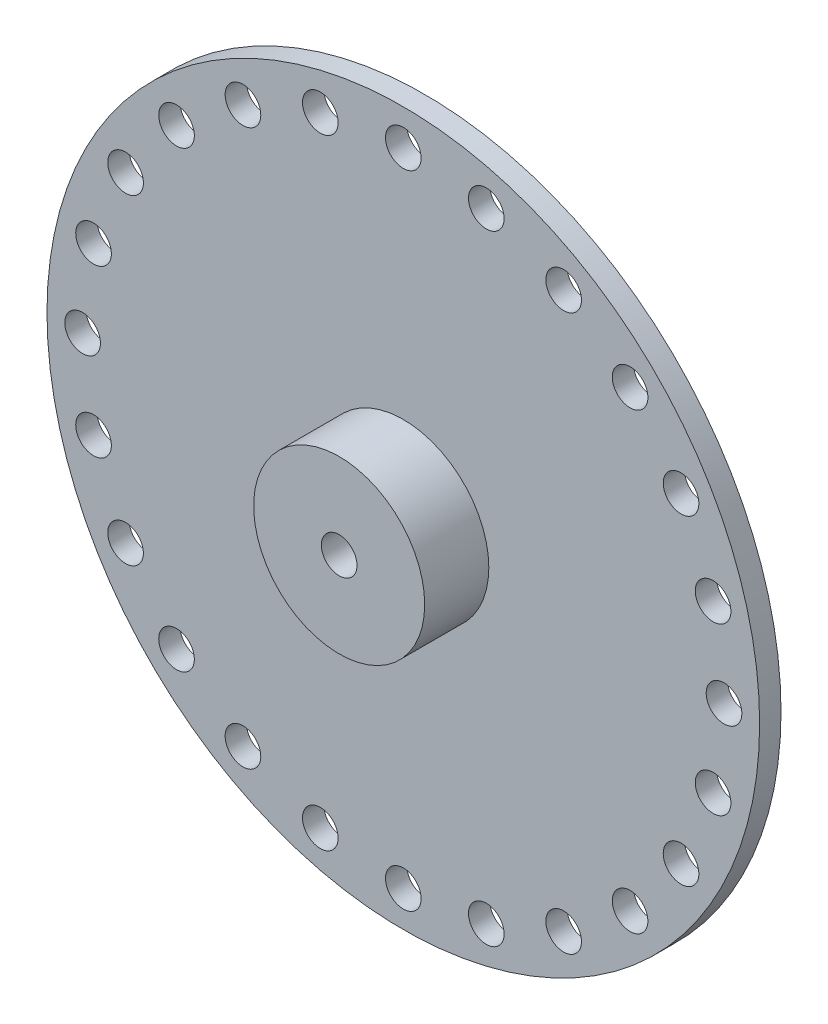
from build123d import *

# Parameters (mm, degrees)
ESBO_O1_R                = 25
RESSALTO_EXTRUS_O1_DEPTH = 1.5
ESBO_O2_R                = 6
RESSALTO_EXTRUS_O2_DEPTH = 4.5
ESBO_O3_R                = 1.25
CORTE_EXTRUS_O1_DEPTH    = 6
ESBO_O4_R                = 1.25
CORTE_EXTRUS_O2_DEPTH    = 1.5
PADR_OCIRCULAR1_COUNT    = 24


with BuildPart() as part:
    # Esboço1 → Ressalto-extrusão1 (new body)
    with BuildSketch(Plane.XY):
        Circle(ESBO_O1_R)
    extrude(amount=RESSALTO_EXTRUS_O1_DEPTH)

    # Esboço2 → Ressalto-extrusão2 (add)
    with BuildSketch(Plane.XY.offset(1.5)):
        Circle(ESBO_O2_R)
    extrude(amount=RESSALTO_EXTRUS_O2_DEPTH)

    # Esboço3 → Corte-extrusão1 (cut)
    with BuildSketch(Plane.XY.offset(6)):
        Circle(ESBO_O3_R)
    extrude(amount=-CORTE_EXTRUS_O1_DEPTH, mode=Mode.SUBTRACT)

    # Esboço4 → Corte-extrusão2 (cut)
    with BuildSketch(Plane(origin=(0, 0, 0), x_dir=(-1, 0, 0), z_dir=(0, 0, -1))):
        with Locations((0, 22.5)):
            Circle(ESBO_O4_R)
    corte_extrus_o2 = extrude(amount=-CORTE_EXTRUS_O2_DEPTH, mode=Mode.SUBTRACT)

    # PadrãoCircular1: Corte-extrusão2 ×24 about axis
    padr_ocircular1_axis = Axis((0, 0, 0), (0, 0, 1))
    for i in range(1, PADR_OCIRCULAR1_COUNT):
        add(corte_extrus_o2.rotate(padr_ocircular1_axis, i * 360 / PADR_OCIRCULAR1_COUNT), mode=Mode.SUBTRACT)


solid = part.part
